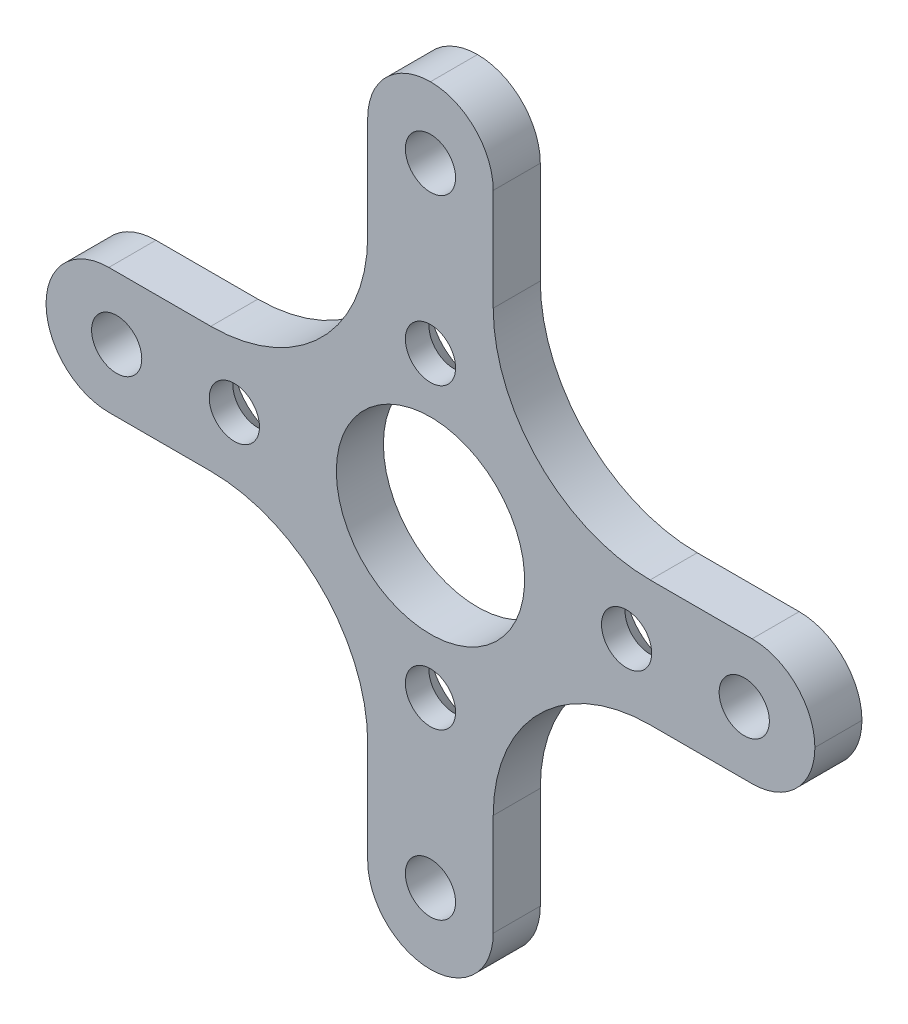
from build123d import *

# Parameters (mm, degrees)
BOSS_EXTRU_1_DEPTH      = 3
ENL_V_MAT_EXTRU_1_REACH = 44.796
ESQUISSE2_R             = 1.6
CONG_1_R                = 10
CONG_2_R                = 4
ENL_V_MAT_EXTRU_2_REACH = 44.796
ESQUISSE3_R             = 6
CHANFREIN1_SIZE         = 1.5


with BuildPart() as part:
    # Esquisse1 → Boss.-Extru.1 (new body)
    with BuildSketch(Plane.XY):
        Polygon((-11.28415855, 20.5), (-11.28415855, 0), (-31.78415855, 0), (-31.78415855, -8), (-11.28415855, -8), (-11.28415855, -28.5), (-3.28415855, -28.5), (-3.28415855, -8), (17.21584145, -8), (17.21584145, 0), (-3.28415855, 0), (-3.28415855, 20.5), align=None)
    extrude(amount=BOSS_EXTRU_1_DEPTH)

    # Esquisse2 → Enlèv. mat.-Extru.1 (cut, up to next)
    with BuildSketch(Plane.XY.offset(3), mode=Mode.PRIVATE) as enl_v_mat_extru_1_sk1:
        with Locations((-27.28415855, -4)):
            Circle(ESQUISSE2_R)
    enl_v_mat_extru_1_tool1 = extrude(enl_v_mat_extru_1_sk1.sketch, amount=-ENL_V_MAT_EXTRU_1_REACH, mode=Mode.PRIVATE) & part.part
    # Esquisse2 → Enlèv. mat.-Extru.1 (cut, up to next)
    with BuildSketch(Plane.XY.offset(3), mode=Mode.PRIVATE) as enl_v_mat_extru_1_sk2:
        with Locations((-19.78415855, -4)):
            Circle(ESQUISSE2_R)
    enl_v_mat_extru_1_tool2 = extrude(enl_v_mat_extru_1_sk2.sketch, amount=-ENL_V_MAT_EXTRU_1_REACH, mode=Mode.PRIVATE) & part.part
    # Esquisse2 → Enlèv. mat.-Extru.1 (cut, up to next)
    with BuildSketch(Plane.XY.offset(3), mode=Mode.PRIVATE) as enl_v_mat_extru_1_sk3:
        with Locations((-7.28415855, -13.5)):
            Circle(ESQUISSE2_R)
    enl_v_mat_extru_1_tool3 = extrude(enl_v_mat_extru_1_sk3.sketch, amount=-ENL_V_MAT_EXTRU_1_REACH, mode=Mode.PRIVATE) & part.part
    # Esquisse2 → Enlèv. mat.-Extru.1 (cut, up to next)
    with BuildSketch(Plane.XY.offset(3), mode=Mode.PRIVATE) as enl_v_mat_extru_1_sk4:
        with Locations((-7.28415855, 5.5)):
            Circle(ESQUISSE2_R)
    enl_v_mat_extru_1_tool4 = extrude(enl_v_mat_extru_1_sk4.sketch, amount=-ENL_V_MAT_EXTRU_1_REACH, mode=Mode.PRIVATE) & part.part
    # Esquisse2 → Enlèv. mat.-Extru.1 (cut, up to next)
    with BuildSketch(Plane.XY.offset(3), mode=Mode.PRIVATE) as enl_v_mat_extru_1_sk5:
        with Locations((-7.28415855, 16)):
            Circle(ESQUISSE2_R)
    enl_v_mat_extru_1_tool5 = extrude(enl_v_mat_extru_1_sk5.sketch, amount=-ENL_V_MAT_EXTRU_1_REACH, mode=Mode.PRIVATE) & part.part
    # Esquisse2 → Enlèv. mat.-Extru.1 (cut, up to next)
    with BuildSketch(Plane.XY.offset(3), mode=Mode.PRIVATE) as enl_v_mat_extru_1_sk6:
        with Locations((5.21584145, -4)):
            Circle(ESQUISSE2_R)
    enl_v_mat_extru_1_tool6 = extrude(enl_v_mat_extru_1_sk6.sketch, amount=-ENL_V_MAT_EXTRU_1_REACH, mode=Mode.PRIVATE) & part.part
    # Esquisse2 → Enlèv. mat.-Extru.1 (cut, up to next)
    with BuildSketch(Plane.XY.offset(3), mode=Mode.PRIVATE) as enl_v_mat_extru_1_sk7:
        with Locations((12.71584145, -4)):
            Circle(ESQUISSE2_R)
    enl_v_mat_extru_1_tool7 = extrude(enl_v_mat_extru_1_sk7.sketch, amount=-ENL_V_MAT_EXTRU_1_REACH, mode=Mode.PRIVATE) & part.part
    # Esquisse2 → Enlèv. mat.-Extru.1 (cut, up to next)
    with BuildSketch(Plane.XY.offset(3), mode=Mode.PRIVATE) as enl_v_mat_extru_1_sk8:
        with Locations((-7.28415855, -24)):
            Circle(ESQUISSE2_R)
    enl_v_mat_extru_1_tool8 = extrude(enl_v_mat_extru_1_sk8.sketch, amount=-ENL_V_MAT_EXTRU_1_REACH, mode=Mode.PRIVATE) & part.part
    add(enl_v_mat_extru_1_tool1.solids().sort_by_distance((-27.284159, -4, 3))[0], mode=Mode.SUBTRACT)
    add(enl_v_mat_extru_1_tool2.solids().sort_by_distance((-19.784159, -4, 3))[0], mode=Mode.SUBTRACT)
    add(enl_v_mat_extru_1_tool3.solids().sort_by_distance((-7.284159, -13.5, 3))[0], mode=Mode.SUBTRACT)
    add(enl_v_mat_extru_1_tool4.solids().sort_by_distance((-7.284159, 5.5, 3))[0], mode=Mode.SUBTRACT)
    add(enl_v_mat_extru_1_tool5.solids().sort_by_distance((-7.284159, 16, 3))[0], mode=Mode.SUBTRACT)
    add(enl_v_mat_extru_1_tool6.solids().sort_by_distance((5.215841, -4, 3))[0], mode=Mode.SUBTRACT)
    add(enl_v_mat_extru_1_tool7.solids().sort_by_distance((12.715841, -4, 3))[0], mode=Mode.SUBTRACT)
    add(enl_v_mat_extru_1_tool8.solids().sort_by_distance((-7.284159, -24, 3))[0], mode=Mode.SUBTRACT)

    # Congé1
    cong_1_edges = [part.edges().sort_by_distance(p)[0] for p in [
        (-3.28415855, 0, 1.5),
        (-3.28415855, -8, 1.5),
        (-11.28415855, -8, 1.5),
        (-11.28415855, 0, 1.5),
    ]]
    fillet(cong_1_edges, radius=CONG_1_R)

    # Congé2
    cong_2_edges = [part.edges().sort_by_distance(p)[0] for p in [
        (-11.28415855, -28.5, 1.5),
        (-3.28415855, -28.5, 1.5),
        (17.21584145, -8, 1.5),
        (17.21584145, 0, 1.5),
        (-3.28415855, 20.5, 1.5),
        (-11.28415855, 20.5, 1.5),
        (-31.78415855, -8, 1.5),
        (-31.78415855, 0, 1.5),
    ]]
    fillet(cong_2_edges, radius=CONG_2_R - 0.0001)  # a hair under: the kernel refuses the full size

    # Esquisse3 → Enlèv. mat.-Extru.2 (cut, up to next)
    with BuildSketch(Plane(origin=(0, 0, 0), x_dir=(-1, 0, 0), z_dir=(0, 0, -1)), mode=Mode.PRIVATE) as enl_v_mat_extru_2_sk1:
        with Locations((7.28415855, -4)):
            Circle(ESQUISSE3_R)
    enl_v_mat_extru_2_tool1 = extrude(enl_v_mat_extru_2_sk1.sketch, amount=-ENL_V_MAT_EXTRU_2_REACH, mode=Mode.PRIVATE) & part.part
    add(enl_v_mat_extru_2_tool1.solids().sort_by_distance((-7.284159, -4, 0))[0], mode=Mode.SUBTRACT)

    # Chanfrein1
    chanfrein1_edges = [part.edges().sort_by_distance(p)[0] for p in [
        (3.61584145, -4, 0),
        (-8.88415855, 5.5, 0),
        (-8.88415855, -13.5, 0),
        (-21.38415855, -4, 0),
    ]]
    chamfer(chanfrein1_edges, length=CHANFREIN1_SIZE)


solid = part.part
